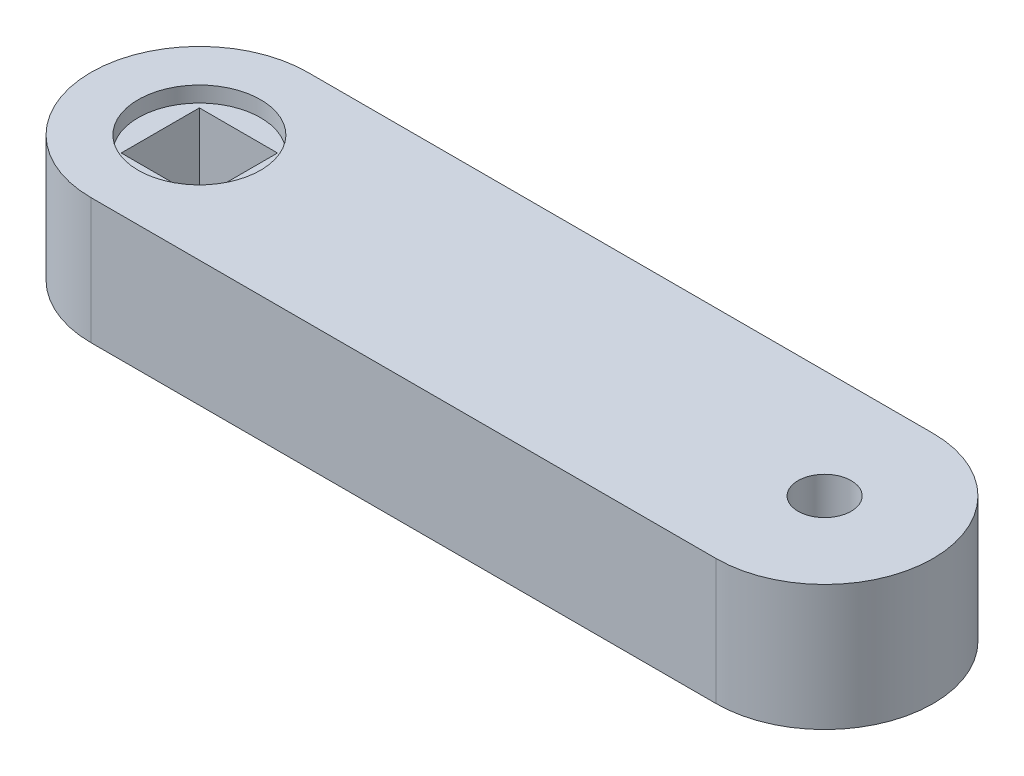
from build123d import *

# Parameters (mm, degrees)
BOSS_EXTRUDE1_DEPTH = 10.2108
SKETCH2_R           = 2.159
SKETCH2_W           = 6.35
SKETCH2_H           = 6.35
CUT_EXTRUDE1_DEPTH  = 62.117955088
SKETCH3_R           = 4.97205
CUT_EXTRUDE2_DEPTH  = 1.27


with BuildPart() as part:
    # Sketch1 → Boss-Extrude1 (new body)
    with BuildSketch(Plane(origin=(0, 0, 0), x_dir=(1, 0, 0), z_dir=(0, 1, 0))):
        with BuildLine():
            Line((0, 8.811284669), (50.8, 8.811284669))
            ThreePointArc((50.8, 8.811284669), (59.611284669, 0), (50.8, -8.811284669))
            Line((50.8, -8.811284669), (0, -8.811284669))
            ThreePointArc((0, -8.811284669), (-8.811284669, 0), (0, 8.811284669))
        make_face()
    extrude(amount=BOSS_EXTRUDE1_DEPTH)

    # Sketch2 → Cut-Extrude1 (cut, through all)
    with BuildSketch(Plane(origin=(0, 10.2108, 0), x_dir=(1, 0, 0), z_dir=(0, 1, 0))):
        with Locations((50.8, 0)):
            Circle(SKETCH2_R)
        Rectangle(SKETCH2_W, SKETCH2_H)
    extrude(amount=-CUT_EXTRUDE1_DEPTH, mode=Mode.SUBTRACT)

    # Sketch3 → Cut-Extrude2 (cut)
    with BuildSketch(Plane(origin=(0, 10.2108, 0), x_dir=(1, 0, 0), z_dir=(0, 1, 0))):
        Circle(SKETCH3_R)
    cut_extrude2 = extrude(amount=-CUT_EXTRUDE2_DEPTH, mode=Mode.SUBTRACT)

    # Mirror1: Cut-Extrude2 across plane
    add(cut_extrude2.mirror(Plane.ZX.offset(5.1054)), mode=Mode.SUBTRACT)


solid = part.part
